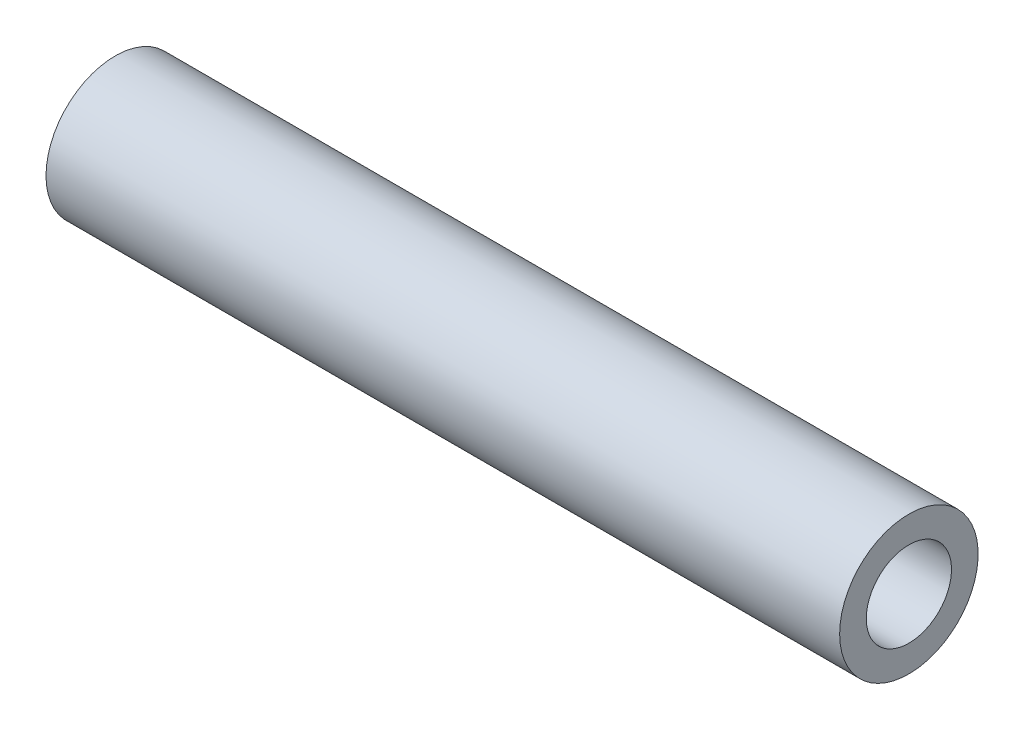
from build123d import *

# Parameters (mm, degrees)
SKETCH1_W = 149
SKETCH1_H = 5


with BuildPart() as part:
    # Sketch1 → Revolve1 (revolve)
    with BuildSketch(Plane.XY):
        with Locations((0, 10.5)):
            Rectangle(SKETCH1_W, SKETCH1_H)
    revolve(axis=Axis((-101.395540413, 0, 0), (1, 0, 0)))


solid = part.part
